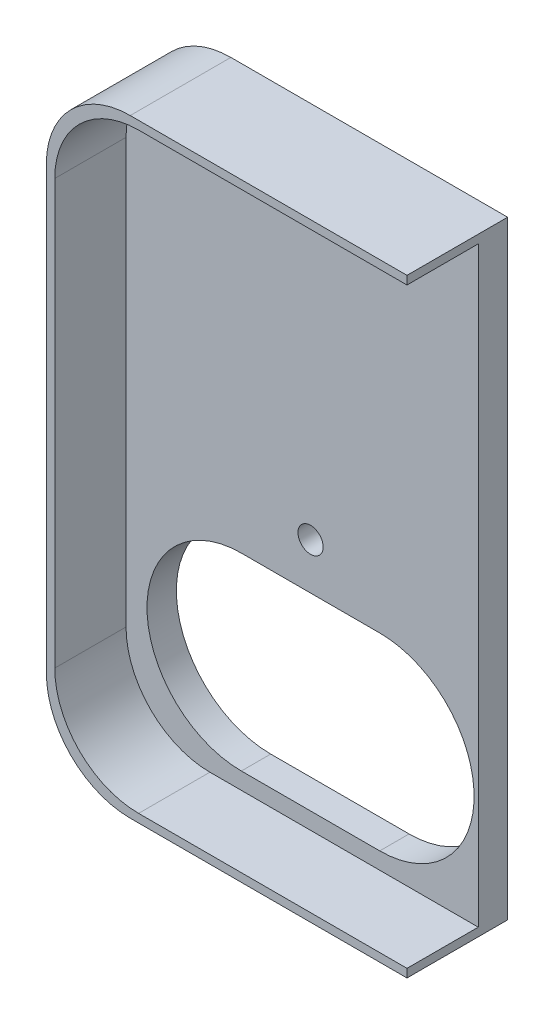
from build123d import *

# Parameters (mm, degrees)
BOSS_EXTRUDE2_DEPTH = 12
CUT_EXTRUDE1_DEPTH  = 8.5
SKETCH6_R           = 1.5
CUT_EXTRUDE2_DEPTH  = 8.5


with BuildPart() as part:
    # Sketch2 → Boss-Extrude2 (new body)
    with BuildSketch(Plane(origin=(0, 0, 0), x_dir=(0, 1, 0), z_dir=(0, 0, 1))):
        with BuildLine():
            Line((-36.28, 11.5), (-36.28, -21.5))
            Line((-36.28, -21.5), (36.28, -21.5))
            Line((36.28, -21.5), (36.28, 11.5))
            ThreePointArc((36.28, 11.5), (33.351067812, 18.571067812), (26.28, 21.5))
            Line((26.28, 21.5), (-26.28, 21.5))
            ThreePointArc((-26.28, 21.5), (-33.351067812, 18.571067812), (-36.28, 11.5))
        make_face()
    extrude(amount=BOSS_EXTRUDE2_DEPTH)

    # Sketch5 → Cut-Extrude1 (cut)
    with BuildSketch(Plane.XY.offset(12)):
        with BuildLine():
            Line((21.5, -35.28), (-10.5, -35.28))
            ThreePointArc((-10.5, -35.28), (-17.571067812, -32.351067812), (-20.5, -25.28))
            Line((-20.5, -25.28), (-20.5, 25.28))
            ThreePointArc((-20.5, 25.28), (-17.571067812, 32.351067812), (-10.5, 35.28))
            Line((-10.5, 35.28), (21.5, 35.28))
            Line((21.5, 35.28), (21.5, -35.28))
        make_face()
    extrude(amount=-CUT_EXTRUDE1_DEPTH, mode=Mode.SUBTRACT)

    # Sketch6 → Cut-Extrude2 (cut)
    with BuildSketch(Plane.XY.offset(3.5)):
        with Locations((1.5, -5.28)):
            Circle(SKETCH6_R)
        with BuildLine():
            Line((9.75, -33.28), (-6.75, -33.28))
            ThreePointArc((-6.75, -33.28), (-18, -22.03), (-6.75, -10.78))
            Line((-6.75, -10.78), (9.75, -10.78))
            ThreePointArc((9.75, -10.78), (21, -22.03), (9.75, -33.28))
        make_face()
    extrude(amount=-CUT_EXTRUDE2_DEPTH, mode=Mode.SUBTRACT)


solid = part.part
